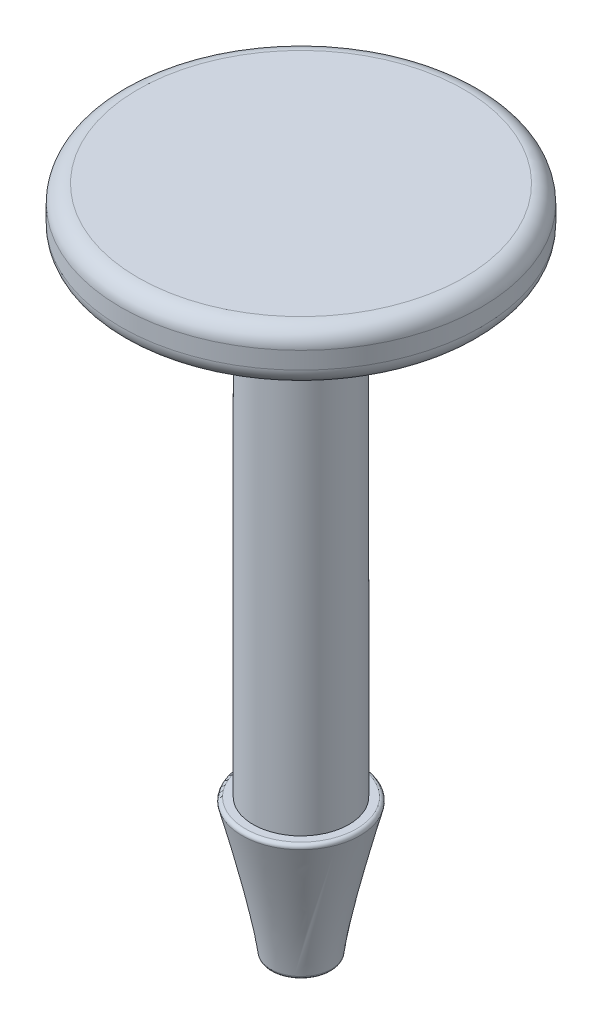
from build123d import *

# Parameters (mm, degrees)
SKETCH1_R           = 1.75
BOSS_EXTRUDE2_DEPTH = 18
SKETCH2_R           = 5.2575
BOSS_EXTRUDE3_DEPTH = 1.5
CUT_EXTRUDE1_START  = 11.5
SKETCH9_R           = 1.75
CUT_EXTRUDE1_DEPTH  = 11.5
SKETCH10_R          = 1.75
SKETCH10_R_2        = 1.4
CUT_EXTRUDE3_DEPTH  = 14
FILLET2_R           = 0.1
FILLET3_R           = 0.1
FILLET4_R           = 0.5


with BuildPart() as part:
    # Sketch1 → Boss-Extrude2 (new body)
    with BuildSketch(Plane(origin=(0, 0, 0), x_dir=(1, 0, 0), z_dir=(0, 1, 0))):
        with Locations(Location((0, 0, 0), (0, 0, 270))):
            Circle(SKETCH1_R)
    extrude(amount=BOSS_EXTRUDE2_DEPTH)

    # Sketch2 → Boss-Extrude3 (add)
    with BuildSketch(Plane(origin=(0, 18, 0), x_dir=(1, 0, 0), z_dir=(0, 1, 0))):
        with Locations(Location((0, 0, 0), (0, 0, 270))):
            Circle(SKETCH2_R)
    extrude(amount=BOSS_EXTRUDE3_DEPTH)

    # Sketch9 → Cut-Extrude1 (cut)
    with BuildSketch(Plane(origin=(0, 4, 0), x_dir=(-1, 0, 0), z_dir=(0, -1, 0)).offset(CUT_EXTRUDE1_START)):
        with Locations(Location((0, 0, 0), (0, 0, 90))):
            Circle(SKETCH9_R)
    extrude(amount=-CUT_EXTRUDE1_DEPTH, mode=Mode.SUBTRACT)

    # Loft1: read off the stored shape, not the designer's step
    # Loft1: loft between two sections, ruled curve by curve
    loft1_from = [
        Edge.make_bspline([(1.652055062, 4, 0.577246976), (0.49756111, 4, 3.8813571), (-2.806549014, 4, 2.726863148), (-1.652055062, 4, -0.577246976), (-0.49756111, 4, -3.8813571), (2.806549014, 4, -2.726863148), (1.652055062, 4, 0.577246976)], [0, 0, 0, 0, 0.5, 0.5, 0.5, 1, 1, 1, 1], 3, [1, 0.333333333, 0.333333333, 1, 0.333333333, 0.333333333, 1]),
    ]
    loft1_to = [
        Edge.make_bspline([(0.493640246, 0, 0.722457132), (-0.951274019, 0, 1.709737623), (-1.93855451, 0, 0.264823359), (-0.493640246, 0, -0.722457132), (0.951274019, 0, -1.709737623), (1.93855451, 0, -0.264823359), (0.493640246, 0, 0.722457132)], [0, 0, 0, 0, 0.5, 0.5, 0.5, 1, 1, 1, 1], 3, [1, 0.333333333, 0.333333333, 1, 0.333333333, 0.333333333, 1]),
    ]
    loft1 = Solid(Shell([*[Face.make_surface_from_curves(loft1_from[k], loft1_to[k]) for k in range(1)], Face(Wire(loft1_from)), Face(Wire(loft1_to))]))
    add(loft1)

    # Sketch10 → Cut-Extrude3 (cut)
    with BuildSketch(Plane(origin=(0, 4, 0), x_dir=(-1, 0, 0), z_dir=(0, -1, 0))):
        Circle(SKETCH10_R)
        with Locations(Location((0, 0, 0), (0, 0, 90))):
            Circle(SKETCH10_R_2, mode=Mode.SUBTRACT)
    extrude(amount=-CUT_EXTRUDE3_DEPTH, mode=Mode.SUBTRACT)

    # Fillet2
    fillet2_edges = [part.edges().sort_by_distance(p)[0] for p in [
        (-0.493640246, 0, -0.722457132),
        (-1.652055062, 4, -0.577246976),
    ]]
    fillet(fillet2_edges, radius=FILLET2_R)

    # Fillet3
    fillet3_edges = [part.edges().sort_by_distance(p)[0] for p in [
        (0, 18, 1.4),
    ]]
    fillet(fillet3_edges, radius=FILLET3_R)

    # Fillet4
    fillet4_edges = [part.edges().sort_by_distance(p)[0] for p in [
        (0, 18, -5.2575),
        (0, 19.5, -5.2575),
    ]]
    fillet(fillet4_edges, radius=FILLET4_R)


solid = part.part
